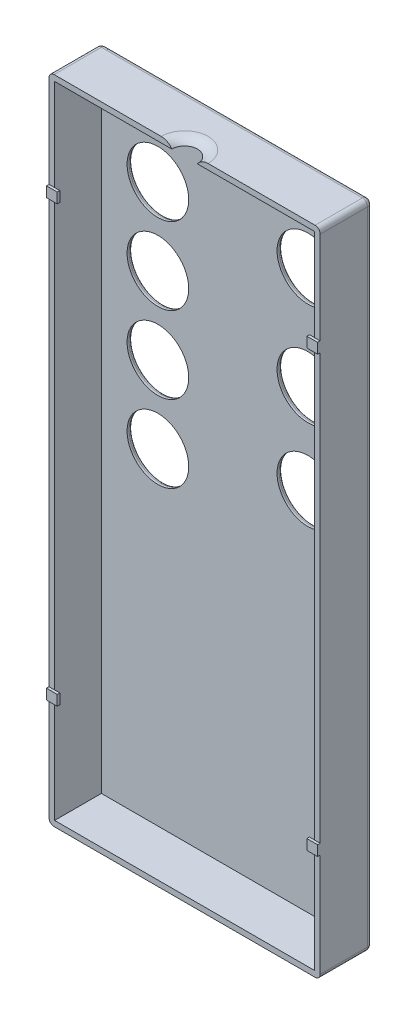
from build123d import *

# Parameters (mm, degrees)
ESQUISSE1_W                  = 50.6
ESQUISSE1_H                  = 124.6
BOSS_EXTRU_1_DEPTH           = 9.1
COQUE7_T                     = 1.1
ENL_V_MAT_EXTRU_2_DEPTH      = 131.47944353
ENL_V_MAT_EXTRU_2_DEPTH_BACK = 7
CONG_1_R                     = 2.5
ESQUISSE6_R                  = 6
ENL_V_MAT_EXTRU_12_DEPTH     = 7
CONG_2_R                     = 0.7
CONG_3_R                     = 1
ESQUISSE8_W                  = 1.1
ESQUISSE8_H                  = 2
ESQUISSE8_W_2                = 1
ESQUISSE8_W_3                = 2.1
BOSS_EXTRU_3_DEPTH           = 0.5
ESQUISSE9_W                  = 2.1
ESQUISSE9_H                  = 2
BOSS_EXTRU_4_DEPTH           = 0.5


with BuildPart() as part:
    # Esquisse1 → Boss.-Extru.1 (new body)
    with BuildSketch(Plane.XY):
        with Locations((-2.991073199, -16.435856056)):
            Rectangle(ESQUISSE1_W, ESQUISSE1_H)
    extrude(amount=BOSS_EXTRU_1_DEPTH)

    # Coque7
    coque7_openings = [part.faces().sort_by_distance(p)[0] for p in [
        (-2.991073199, -16.435856056, 9.1),
    ]]
    offset(amount=COQUE7_T, openings=coque7_openings, kind=Kind.INTERSECTION)

    # Esquisse4 → Enlèv. mat.-Extru.2 (cut, two sides: drawn at the far end of the back side and taken through both)
    with BuildSketch(Plane(origin=(0, 46.964143944, 0), x_dir=(1, 0, 0), z_dir=(0, 1, 0)).offset(-ENL_V_MAT_EXTRU_2_DEPTH_BACK)):
        with BuildLine():
            Line((-5.491073199, -80.394371683), (-5.491073199, -9.1))
            ThreePointArc((-5.491073199, -9.1), (-2.991073199, -6.6), (-0.491073199, -9.1))
            Line((-0.491073199, -9.1), (-0.491073199, -80.394371683))
            Line((-0.491073199, -80.394371683), (-0.491073199, -222.983115049))
            Line((-0.491073199, -222.983115049), (-5.491073199, -222.983115049))
            Line((-5.491073199, -222.983115049), (-5.491073199, -80.394371683))
        make_face()
    extrude(amount=ENL_V_MAT_EXTRU_2_DEPTH + ENL_V_MAT_EXTRU_2_DEPTH_BACK, mode=Mode.SUBTRACT)

    # Congé1
    # the kernel refuses this fillet: 2.5 mm, written as the material it takes off along each edge
    with BuildSketch(Plane(origin=(-2.991073199, 46.964143944, 9.1), x_dir=(-0.0031415874858794265, 0, 0.9999950652018581), z_dir=(0.9999950652018581, 0, 0.0031415874858794265))) as cong_1_piece_1:
        with BuildLine():
            CenterArc((4.571231518, 2.5), CONG_1_R, 214.055797743, 55.944202257)
            Line((4.571231518, 0), (4.571231518, -0.05))
            Line((4.571231518, -0.05), (2.5, -0.05))
            Line((2.5, -0.05), (2.45, 0))
            ThreePointArc((2.45, 0), (2.45, 0.55), (2.45857537, 1.072))
            Line((2.45857537, 1.072), (2.5, 1.1))
        make_face()
    revolve(axis=Axis((-2.991073199, 46.964143944, 9.1), (0, -1, 0)), revolution_arc=359.64, mode=Mode.SUBTRACT)

    # Esquisse6 → Enlèv. mat.-Extru.12 (cut)
    with BuildSketch(Plane(origin=(0, 0, -1.1), x_dir=(-1, 0, 0), z_dir=(0, 0, -1))):
        with Locations((17.291073199, 14.864143944)):
            Circle(ESQUISSE6_R)
        with Locations((17.291073199, 29.864143944)):
            Circle(ESQUISSE6_R)
        with Locations((17.291073199, -0.135856056)):
            Circle(ESQUISSE6_R)
        with Locations((17.291073199, -15.135856056)):
            Circle(ESQUISSE6_R)
        with Locations((-11.908926801, 29.864143944)):
            Circle(ESQUISSE6_R)
        with Locations((-11.908926801, 9.864143944)):
            Circle(ESQUISSE6_R)
        with Locations((-11.908926801, -7.635856056)):
            Circle(ESQUISSE6_R)
    extrude(amount=-ENL_V_MAT_EXTRU_12_DEPTH, mode=Mode.SUBTRACT)

    # Congé2
    cong_2_edges = [part.edges().sort_by_distance(p)[0] for p in [
        (17.908926801, 29.864143944, -1.1),
        (-11.291073199, -15.135856056, -1.1),
        (-11.291073199, -0.135856056, -1.1),
        (-11.291073199, 29.864143944, -1.1),
        (17.908926801, 9.864143944, -1.1),
        (17.908926801, -7.635856056, -1.1),
        (-11.291073199, 14.864143944, -1.1),
    ]]
    fillet(cong_2_edges, radius=CONG_2_R)

    # Congé3
    cong_3_edges = [part.edges().sort_by_distance(p)[0] for p in [
        (-2.991073199, 46.964143944, -1.1),
        (23.408926801, -16.435856056, -1.1),
        (-2.991073199, -79.835856056, -1.1),
        (-29.391073199, -16.435856056, -1.1),
        (-29.391073199, 46.964143944, 4),
        (23.408926801, 46.964143944, 4),
        (23.408926801, -79.835856056, 4),
        (-29.391073199, -79.835856056, 4),
    ]]
    fillet(cong_3_edges, radius=CONG_3_R)

    # Esquisse8 → Boss.-Extru.3 (add)
    with BuildSketch(Plane.XY.offset(9.1)):
        with Locations((22.858926801, 26.964143944)):
            Rectangle(ESQUISSE8_W, ESQUISSE8_H)
        with Locations((21.808926801, 26.964143944)):
            Rectangle(ESQUISSE8_W_2, ESQUISSE8_H)
        with Locations((-28.341073199, 26.964143944)):
            Rectangle(ESQUISSE8_W_3, ESQUISSE8_H)
    extrude(amount=BOSS_EXTRU_3_DEPTH)

    # Esquisse9 → Boss.-Extru.4 (add)
    with BuildSketch(Plane.XY.offset(9.1)):
        with Locations((22.358926801, -57.735856056)):
            Rectangle(ESQUISSE9_W, ESQUISSE9_H)
        with Locations((-28.341073199, -57.735856056)):
            Rectangle(ESQUISSE9_W, ESQUISSE9_H)
    extrude(amount=BOSS_EXTRU_4_DEPTH)


solid = part.part
